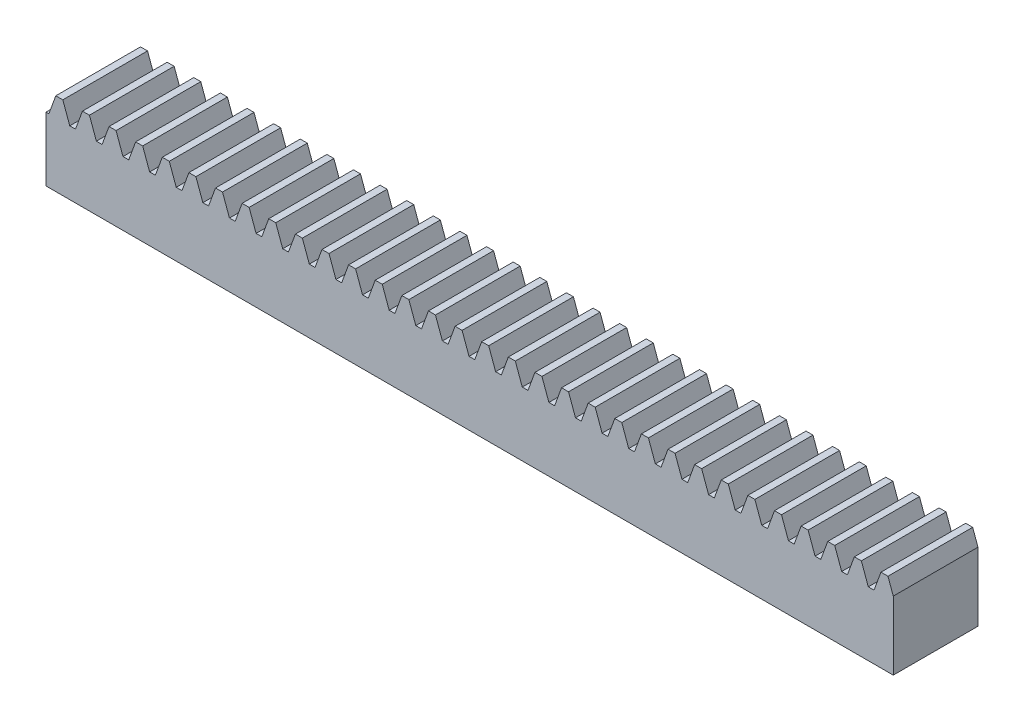
from build123d import *

# Parameters (mm, degrees)
RITNING_1_W          = 250
RITNING_1_H          = 9.8
KUGGST_NGS_MNE_DEPTH = 10
KUGGLUCKA_DEPTH      = 10
LPATTERN_COUNT       = 80
LPATTERN_PITCH       = 3.14159265
CUT_EXTRUDE1_DEPTH   = 10


with BuildPart() as part:
    # Ritning 1 → Kuggstångsämne (new body)
    with BuildSketch(Plane.XY):
        with Locations((0.9, 0)):
            Rectangle(RITNING_1_W, RITNING_1_H)
    extrude(amount=KUGGST_NGS_MNE_DEPTH)

    # Ritning 2 → Kugglucka (cut)
    with BuildSketch(Plane.XY.offset(10)):
        with BuildLine():
            Line((-124.438289352, 2.65), (-123.761710648, 2.65))
            Line((-123.761710648, 2.65), (-122.942777621, 4.9))
            Line((-122.942777621, 4.9), (-124.1, 6.057222379))
            Line((-124.1, 6.057222379), (-125.257222379, 4.9))
            add(Edge.make_bspline(
                [(-125.257222379, 4.9), (-124.984244704, 4.15), (-124.711267028, 3.4), (-124.438289352, 2.65)],
                knots=[0, 0, 0, 0, 1, 1, 1, 1], degree=3))
        make_face()
    kugglucka = extrude(amount=-KUGGLUCKA_DEPTH, mode=Mode.SUBTRACT)

    # LPattern: Kugglucka ×80
    with Locations(*[(i * LPATTERN_PITCH, 0, 0) for i in range(1, LPATTERN_COUNT)]):
        add(kugglucka, mode=Mode.SUBTRACT)

    # Sketch1 → Cut-Extrude1 (cut)
    with BuildSketch(Plane.XY.offset(10)):
        Polygon((-24.1, -4.9), (-24.1, 34.404726266), (165.055883849, 34.404726266), (170.123246632, -36.805056005), (-46.973243137, -44.806155137), align=None)
    extrude(amount=-CUT_EXTRUDE1_DEPTH, mode=Mode.SUBTRACT)


solid = part.part
